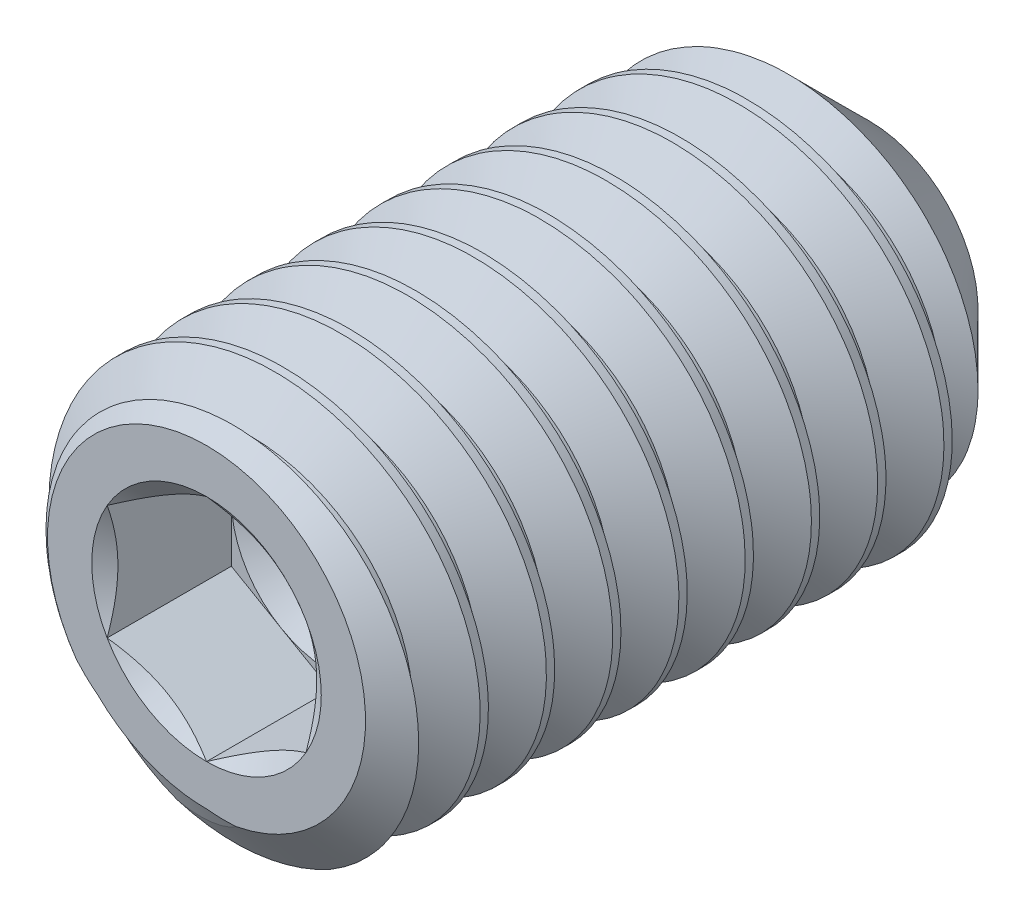
from build123d import *

# Parameters (mm, degrees)
CUT_SWEEP_PITCH   = 0.5
HEX_EXTRUDE_DEPTH = 0.9375


with BuildPart() as part:
    # Body Sketch → Body Revolve (revolve)
    with BuildSketch(Plane(origin=(0, 0, 0), x_dir=(0, 0, -1), z_dir=(1, 0, 0))):
        Polygon((-2.2530621, 0), (-2.2530621, 1.2), (-2.042999839, 1.5), (2.068885259, 1.5), (2.7469379, 0.821947359), (2.2530621, 0), align=None)
    revolve(axis=Axis((0, 0, -2.2530621), (0, 0, 1)))

    # Cut Sweep: the profile of Cut Sweep Sketch profile screwed along a right-hand helix of 11 turns, 6 arcs to a turn; built about Z, then put on its axis
    cut_sweep_z = Axis((0, 0, 0), (0, 0, 1))
    cut_sweep_corners = [(1.5003, 0, 0.000173205), (1.5003, 0, -0.437673205), (1.175240474, 0, -0.25), (1.175240474, 0, -0.1875)]
    with BuildLine(mode=Mode.PRIVATE) as cut_sweep_profile:
        Line(cut_sweep_corners[0], cut_sweep_corners[1])
        Line(cut_sweep_corners[1], cut_sweep_corners[2])
        Line(cut_sweep_corners[2], cut_sweep_corners[3])
        Line(cut_sweep_corners[3], cut_sweep_corners[0])
    cut_sweep_cap = Face(cut_sweep_profile.wire())
    cut_sweep_turn_angles = [0, 30, 60, 90, 120, 150, 180, 210, 240, 270, 300, 330, 360]
    cut_sweep_turn_weights = [1, 0.8660254037844387, 1, 0.8660254037844387, 1, 0.8660254037844387, 1, 0.8660254037844387, 1, 0.8660254037844387, 1, 0.8660254037844387, 1]
    cut_sweep_turn_rails = [Edge.make_bspline([Vector(p[0], p[1], 0).rotate(cut_sweep_z, cut_sweep_turn_angles[k]) / cut_sweep_turn_weights[k] + Vector(0, 0, p[2] + CUT_SWEEP_PITCH * cut_sweep_turn_angles[k] / 360) for k in range(13)], [0, 0, 0, 1, 1, 2, 2, 3, 3, 4, 4, 5, 5, 6, 6, 6], 2, cut_sweep_turn_weights) for p in cut_sweep_corners]
    cut_sweep_turn_sides = [Face.make_surface_from_curves(cut_sweep_turn_rails[p[0]], cut_sweep_turn_rails[p[1]]) for p in [(0, 1), (1, 2), (2, 3), (3, 0)]]
    cut_sweep = Plane(origin=(0, 0, -2.7469379), x_dir=(0, 1, 0), z_dir=(0, 0, 1)) * Solid(Shell([*[p.moved(Location((0, 0, CUT_SWEEP_PITCH * i))) for i in range(11) for p in cut_sweep_turn_sides], cut_sweep_cap, cut_sweep_cap.rotate(cut_sweep_z, 3960).moved(Location((0, 0, CUT_SWEEP_PITCH * 3960 / 360)))]))
    add(cut_sweep, mode=Mode.SUBTRACT)

    # Hex Sketch → Hex Extrude (cut)
    with BuildSketch(Plane.XY.offset(2.2530621)):
        Polygon((0, 0.866025404), (-0.75, 0.433012702), (-0.75, -0.433012702), (0, -0.866025404), (0.75, -0.433012702), (0.75, 0.433012702), align=None)
    extrude(amount=-HEX_EXTRUDE_DEPTH, mode=Mode.SUBTRACT)

    # Hex Entry Extrude cone 1 section (through the dimple's axis) → Hex Entry Extrude (revolve, cut)
    with BuildSketch(Plane(origin=(0, 0, 2.2530621), x_dir=(0, -1, 0), z_dir=(1, 0, 0))):
        Polygon((0, 0), (0.866025404, 0), (0, 0.606397516), align=None)
    revolve(axis=Axis((0, 0, 2.2530621), (0, 0, -1)), mode=Mode.SUBTRACT)

    # Hex Bottom Extrude cone 1 section (through the dimple's axis) → Hex Bottom Extrude (revolve, cut)
    with BuildSketch(Plane(origin=(0, 0, 1.3155621), x_dir=(0, -1, 0), z_dir=(1, 0, 0))):
        Polygon((0, 0), (0.75, 0), (0, 0.433012702), align=None)
    revolve(axis=Axis((0, 0, 1.3155621), (0, 0, -1)), mode=Mode.SUBTRACT)


solid = part.part
